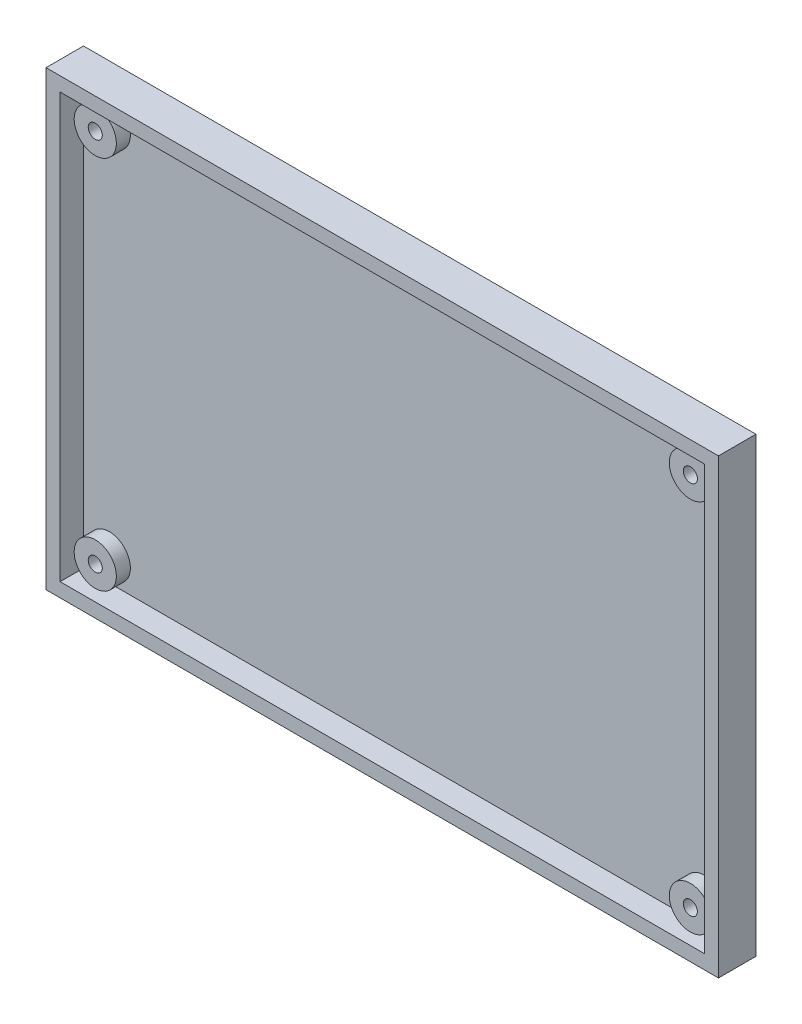
from build123d import *

# Parameters (mm, degrees)
SKETCH1_W           = 143.5
SKETCH1_H           = 96.5
SKETCH1_R           = 1.5
BOSS_EXTRUDE1_DEPTH = 8
SHELL1_T            = -3
SKETCH2_W           = 137.5
SKETCH2_H           = 90.5
CUT_EXTRUDE1_DEPTH  = 2


with BuildPart() as part:
    # Sketch1 → Boss-Extrude1 (new body)
    with BuildSketch(Plane.XY):
        with Locations((71.75, 48.25)):
            Rectangle(SKETCH1_W, SKETCH1_H)
        with Locations((8.5, 88)):
            Circle(SKETCH1_R, mode=Mode.SUBTRACT)
        with Locations((8.5, 8)):
            Circle(SKETCH1_R, mode=Mode.SUBTRACT)
        with Locations((135.5, 8)):
            Circle(SKETCH1_R, mode=Mode.SUBTRACT)
        with Locations((135.5, 88)):
            Circle(SKETCH1_R, mode=Mode.SUBTRACT)
    extrude(amount=BOSS_EXTRUDE1_DEPTH)

    # Shell1
    shell1_openings = [part.faces().sort_by_distance(p)[0] for p in [
        (71.749488506, 48.250511494, 8),
    ]]
    offset(amount=SHELL1_T, openings=shell1_openings, kind=Kind.INTERSECTION)

    # Sketch2 → Cut-Extrude1 (cut)
    with BuildSketch(Plane.XY.offset(8)):
        with Locations((71.75, 48.25)):
            Rectangle(SKETCH2_W, SKETCH2_H)
    extrude(amount=-CUT_EXTRUDE1_DEPTH, mode=Mode.SUBTRACT)


solid = part.part
